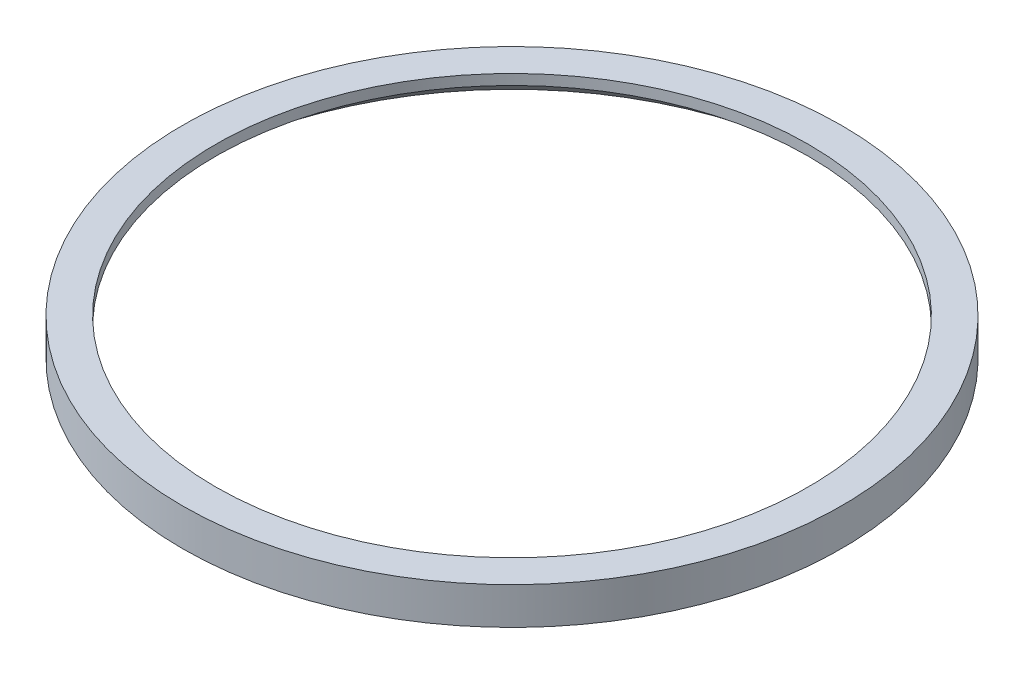
from build123d import *

# Parameters (mm, degrees)
SKETCH1_R           = 44.45
SKETCH1_R_2         = 40
BOSS_EXTRUDE1_DEPTH = 5


with BuildPart() as part:
    # Sketch1 → Boss-Extrude1 (new body)
    with BuildSketch(Plane(origin=(0, 0, 0), x_dir=(1, 0, 0), z_dir=(0, 1, 0))):
        Circle(SKETCH1_R)
        Circle(SKETCH1_R_2, mode=Mode.SUBTRACT)
    extrude(amount=BOSS_EXTRUDE1_DEPTH)

    # Sketch2 → Cut-Revolve1 (revolve, cut)
    with BuildSketch(Plane.XY):
        Polygon((40, 0), (40, 3.6), (44.45, 0), align=None)
    revolve(axis=Axis((0, 0, 0), (0, 1, 0)), mode=Mode.SUBTRACT)


solid = part.part
